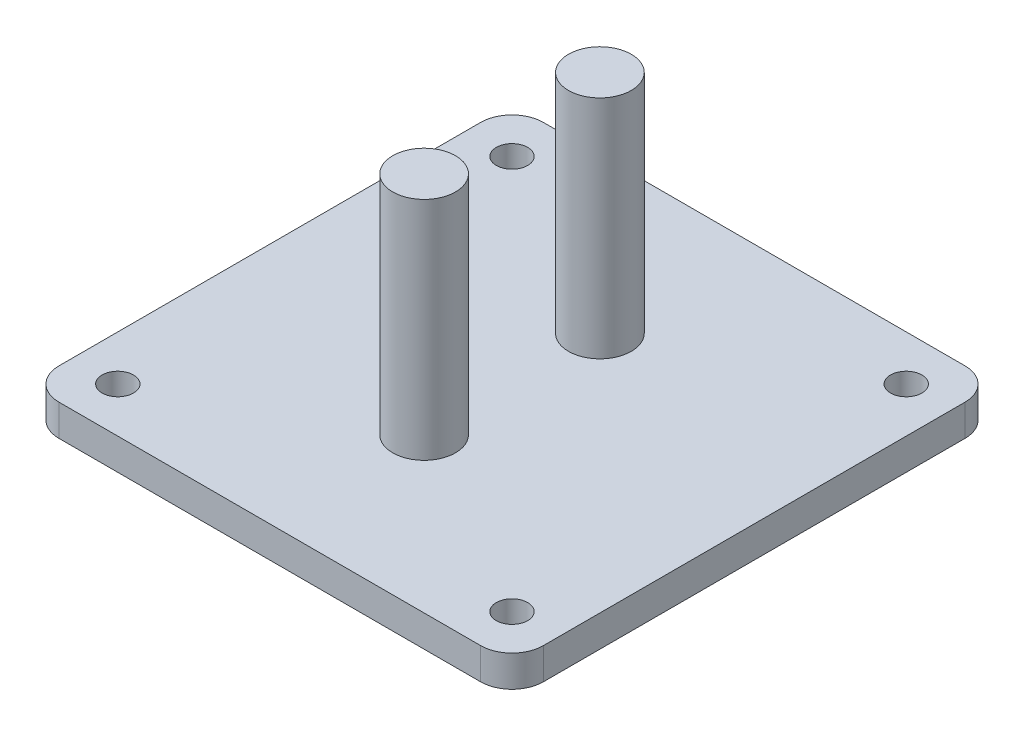
from build123d import *

# Parameters (mm, degrees)
DODANIE_WYCI_GNI_CIE1_DEPTH = 2.5
SZKIC1_4_R                  = 2.5
DODANIE_WYCI_GNI_CIE2_DEPTH = 20.5
SZKIC2_R                    = 1.25
WYTNIJ_WYCI_GNI_CIE1_DEPTH  = 2.5
SZKIC3_R                    = 2.5
WYTNIJ_WYCI_GNI_CIE2_DEPTH  = 1


with BuildPart() as part:
    # Szkic1 → Dodanie-wyciągnięcie1 (new body)
    with BuildSketch(Plane(origin=(0, 0, 0), x_dir=(1, 0, 0), z_dir=(0, 1, 0))):
        with BuildLine():
            Line((16.795, -19.295), (-16.795, -19.295))
            ThreePointArc((-16.795, -19.295), (-18.562766953, -18.562766953), (-19.295, -16.795))
            Line((-19.295, -16.795), (-19.295, 16.795))
            ThreePointArc((-19.295, 16.795), (-18.562766953, 18.562766953), (-16.795, 19.295))
            Line((-16.795, 19.295), (16.795, 19.295))
            ThreePointArc((16.795, 19.295), (18.562766953, 18.562766953), (19.295, 16.795))
            Line((19.295, 16.795), (19.295, -16.795))
            ThreePointArc((19.295, -16.795), (18.562766953, -18.562766953), (16.795, -19.295))
        make_face()
    extrude(amount=DODANIE_WYCI_GNI_CIE1_DEPTH)

    # Szkic1<4> → Dodanie-wyciągnięcie2 (add)
    with BuildSketch(Plane(origin=(0, 0, 0), x_dir=(1, 0, 0), z_dir=(0, 1, 0))):
        with Locations((0, 7)):
            Circle(SZKIC1_4_R)
        with Locations((0, -7)):
            Circle(SZKIC1_4_R)
    extrude(amount=DODANIE_WYCI_GNI_CIE2_DEPTH)

    # Szkic2 → Wytnij-wyciągnięcie1 (cut)
    with BuildSketch(Plane(origin=(0, 2.5, 0), x_dir=(1, 0, 0), z_dir=(0, 1, 0))):
        with Locations((-15.7, 15.7)):
            Circle(SZKIC2_R)
        with Locations((15.7, 15.7)):
            Circle(SZKIC2_R)
        with Locations((15.7, -15.7)):
            Circle(SZKIC2_R)
        with Locations((-15.7, -15.7)):
            Circle(SZKIC2_R)
    extrude(amount=-WYTNIJ_WYCI_GNI_CIE1_DEPTH, mode=Mode.SUBTRACT)

    # Szkic3 → Wytnij-wyciągnięcie2 (cut)
    with BuildSketch(Plane.XZ):
        with Locations((-12.3, 0)):
            Circle(SZKIC3_R)
        with Locations((12.3, 0)):
            Circle(SZKIC3_R)
    extrude(amount=-WYTNIJ_WYCI_GNI_CIE2_DEPTH, mode=Mode.SUBTRACT)


solid = part.part
